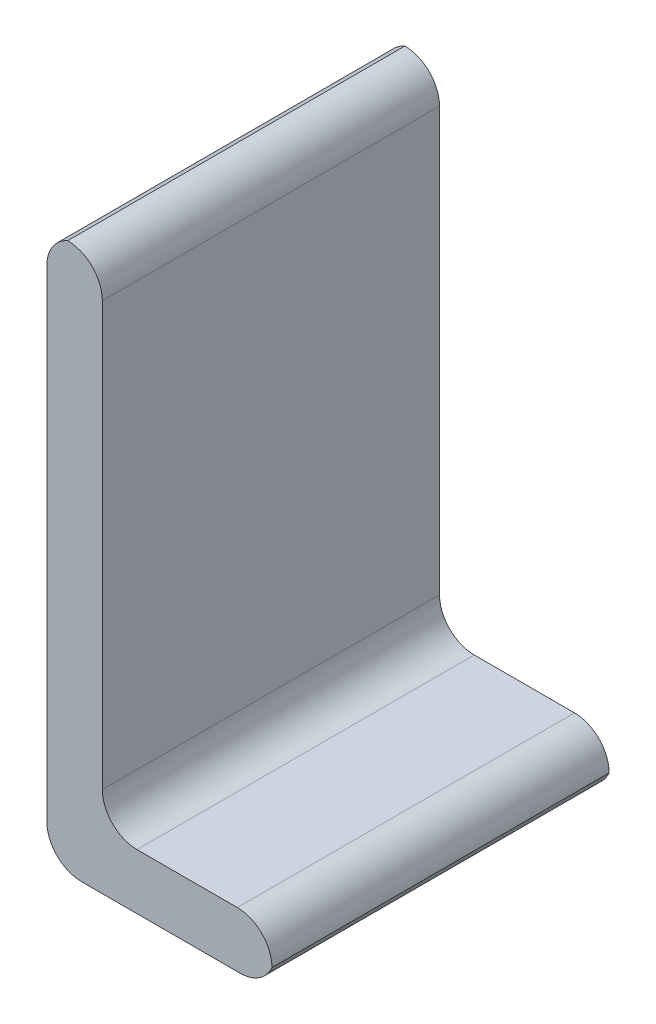
from build123d import *

# Parameters (mm, degrees)
BOSS_EXTRUDE1_DEPTH = 48.62


with BuildPart() as part:
    # Sketch2 → Boss-Extrude1 (new body)
    with BuildSketch(Plane.XY):
        with BuildLine():
            Line((0, 5), (0, 74.46))
            ThreePointArc((0, 74.46), (0.816699867, 77.198612788), (3, 79.042575695))
            ThreePointArc((3, 79.042575695), (6.535533906, 77.578109601), (8, 74.042575695))
            Line((8, 74.042575695), (8, 13))
            ThreePointArc((8, 13), (9.464466094, 9.464466094), (13, 8))
            Line((13, 8), (27.46, 8))
            ThreePointArc((27.46, 8), (30.995533906, 6.535533906), (32.46, 3))
            ThreePointArc((32.46, 3), (30.616037093, 0.816699867), (27.877424305, 0))
            Line((27.877424305, 0), (8, 0))
            Line((8, 0), (5, 0))
            ThreePointArc((5, 0), (1.464466094, 1.464466094), (0, 5))
        make_face()
    extrude(amount=BOSS_EXTRUDE1_DEPTH)


solid = part.part
